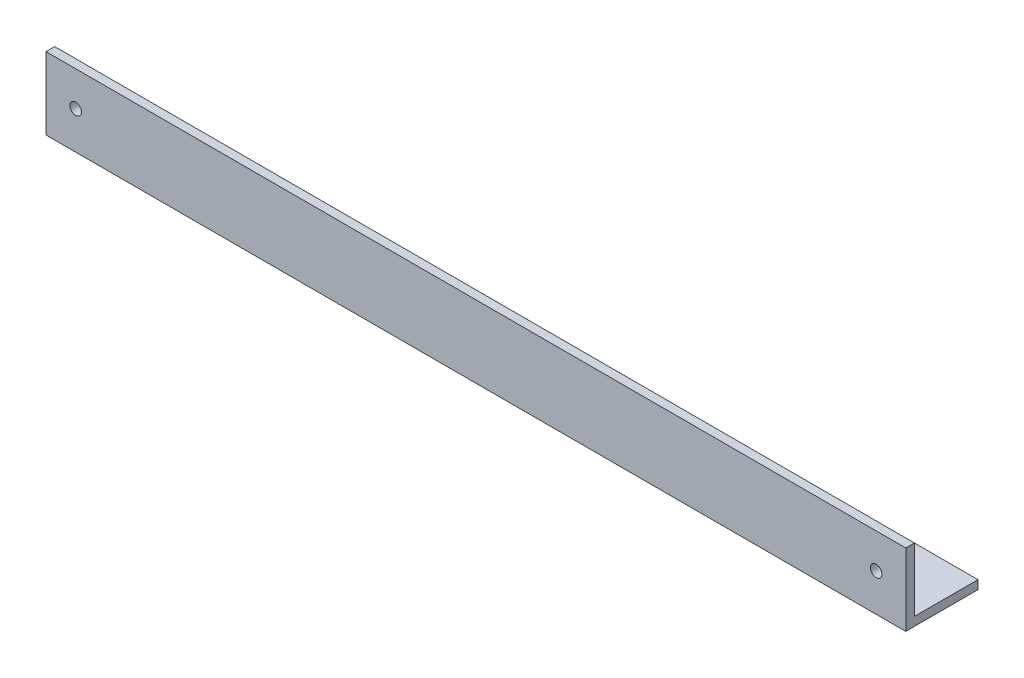
from build123d import *

# Parameters (mm, degrees)
EXTRUDE_2_DEPTH     = 595
SKETCH_2_R          = 4
CUT_EXTRUDE_1_DEPTH = 600.186949124


with BuildPart() as part:
    # Эскиз1 → Вытянуть-Тонкостенный2 (new body)
    with BuildSketch(Plane(origin=(0, 0, 0), x_dir=(0, 0, -1), z_dir=(1, 0, 0))):
        Polygon((0, 50), (0, 0), (50, 0), (50, 6), (6, 6), (6, 50), align=None)
    extrude(amount=EXTRUDE_2_DEPTH)

    # Эскиз2 → Вырез-Вытянуть1 (cut, through all)
    with BuildSketch(Plane.XY):
        with Locations((20.5, 26)):
            Circle(SKETCH_2_R)
        with Locations((574.5, 26)):
            Circle(SKETCH_2_R)
    extrude(amount=-CUT_EXTRUDE_1_DEPTH, mode=Mode.SUBTRACT)


solid = part.part
